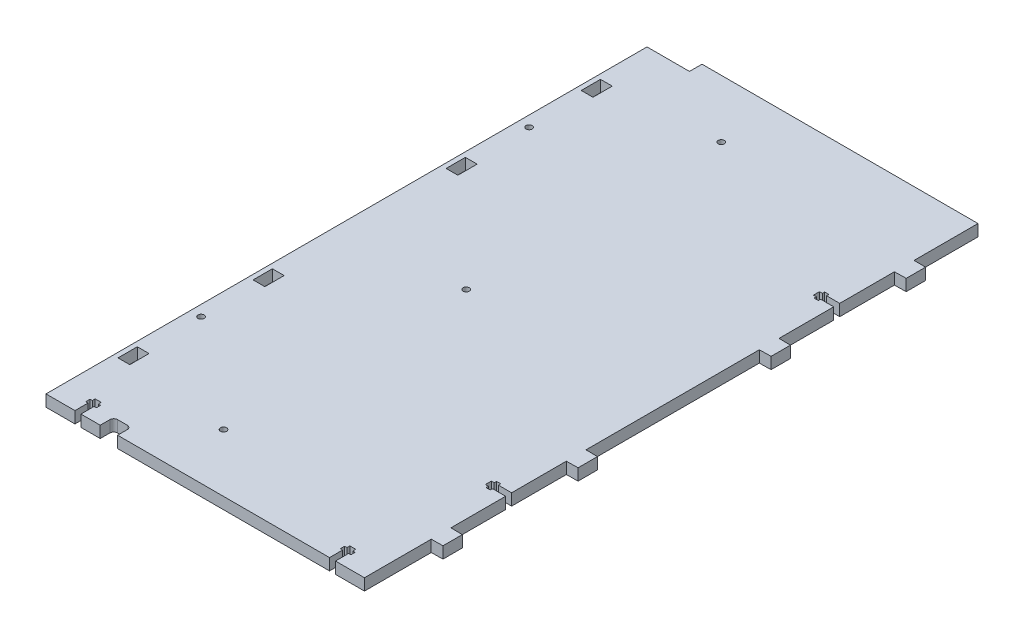
from build123d import *

# Parameters (mm, degrees)
SKETCH_1_R      = 1.6
SKETCH_1_W      = 6.1
SKETCH_1_H      = 10
EXTRUDE_1_DEPTH = 6


with BuildPart() as part:
    # Эскиз1 → Бобышка-Вытянуть1 (new body)
    with BuildSketch(Plane(origin=(0, 0, 6), x_dir=(1, 0, 0), z_dir=(0, 1, 0))):
        with BuildLine():
            Line((933.155518961, 517.721066), (933.155518961, 552.32339))
            Line((933.155518961, 552.32339), (939.155518961, 552.42339))
            Line((939.155518961, 552.42339), (939.155518961, 562.42339))
            Line((939.155518961, 562.42339), (933.155518961, 562.52339))
            Line((933.155518961, 562.52339), (933.155518961, 590.87339))
            Line((933.155518961, 590.87339), (926.355518961, 590.87339))
            Line((926.355518961, 590.87339), (926.355518961, 589.67339))
            Line((926.355518961, 589.67339), (924.155518961, 589.67339))
            Line((924.155518961, 589.67339), (924.155518961, 590.87339))
            Line((924.155518961, 590.87339), (922.655518961, 590.87339))
            Line((922.655518961, 590.87339), (922.655518961, 593.97339))
            Line((922.655518961, 593.97339), (924.155518961, 593.97339))
            Line((924.155518961, 593.97339), (924.155518961, 595.17339))
            Line((924.155518961, 595.17339), (926.355518961, 595.17339))
            Line((926.355518961, 595.17339), (926.355518961, 593.97339))
            Line((926.355518961, 593.97339), (933.155518961, 593.97339))
            Line((933.155518961, 593.97339), (933.155518961, 622.32339))
            Line((933.155518961, 622.32339), (939.155518961, 622.42339))
            Line((939.155518961, 622.42339), (939.155518961, 632.42339))
            Line((939.155518961, 632.42339), (933.155518961, 632.52339))
            Line((933.155518961, 632.52339), (933.155518961, 722.32339))
            Line((933.155518961, 722.32339), (939.155518961, 722.42339))
            Line((939.155518961, 722.42339), (939.155518961, 732.42339))
            Line((939.155518961, 732.42339), (933.155518961, 732.52339))
            Line((933.155518961, 732.52339), (933.155518961, 760.87339))
            Line((933.155518961, 760.87339), (926.355518961, 760.87339))
            Line((926.355518961, 760.87339), (926.355518961, 759.67339))
            Line((926.355518961, 759.67339), (924.155518961, 759.67339))
            Line((924.155518961, 759.67339), (924.155518961, 760.87339))
            Line((924.155518961, 760.87339), (922.655518961, 760.87339))
            Line((922.655518961, 760.87339), (922.655518961, 763.97339))
            Line((922.655518961, 763.97339), (924.155518961, 763.97339))
            Line((924.155518961, 763.97339), (924.155518961, 765.17339))
            Line((924.155518961, 765.17339), (926.355518961, 765.17339))
            Line((926.355518961, 765.17339), (926.355518961, 763.97339))
            Line((926.355518961, 763.97339), (933.155518961, 763.97339))
            Line((933.155518961, 763.97339), (933.155518961, 792.32339))
            Line((933.155518961, 792.32339), (939.155518961, 792.42339))
            Line((939.155518961, 792.42339), (939.155518961, 802.42339))
            Line((939.155518961, 802.42339), (933.155518961, 802.52339))
            Line((933.155518961, 802.52339), (933.155518961, 835.62339))
            Line((933.155518961, 835.62339), (833.155518961, 835.62339))
            Line((833.155518961, 835.62339), (790.155518961, 835.62339))
            Line((790.155518961, 835.62339), (790.155518961, 829.12339))
            Line((790.155518961, 829.12339), (768.155518961, 829.12339))
            Line((768.155518961, 829.12339), (768.155518961, 517.721066))
            Line((768.155518961, 517.721066), (783.155518961, 517.721066))
            Line((783.155518961, 517.721066), (783.155518961, 524.521066))
            Line((783.155518961, 524.521066), (781.955518961, 524.521066))
            Line((781.955518961, 524.521066), (781.955518961, 526.721066))
            Line((781.955518961, 526.721066), (783.155518961, 526.721066))
            Line((783.155518961, 526.721066), (783.155518961, 528.221066))
            Line((783.155518961, 528.221066), (786.255518961, 528.221066))
            Line((786.255518961, 528.221066), (786.255518961, 526.721066))
            Line((786.255518961, 526.721066), (787.455518961, 526.721066))
            Line((787.455518961, 526.721066), (787.455518961, 524.521066))
            Line((787.455518961, 524.521066), (786.255518961, 524.521066))
            Line((786.255518961, 524.521066), (786.255518961, 517.721066))
            Line((786.255518961, 517.721066), (796.255518961, 517.721066))
            Line((796.255518961, 517.721066), (796.255518961, 522.721066))
            ThreePointArc((796.255518961, 522.721066), (796.841305399, 524.135279562), (798.255518961, 524.721066))
            Line((798.255518961, 524.721066), (803.255518961, 524.721066))
            ThreePointArc((803.255518961, 524.721066), (804.669732523, 524.135279562), (805.255518961, 522.721066))
            Line((805.255518961, 522.721066), (805.255518961, 517.721066))
            Line((805.255518961, 517.721066), (833.155518961, 517.721066))
            Line((833.155518961, 517.721066), (915.055518961, 517.721066))
            Line((915.055518961, 517.721066), (915.055518961, 524.521066))
            Line((915.055518961, 524.521066), (913.855518961, 524.521066))
            Line((913.855518961, 524.521066), (913.855518961, 526.721066))
            Line((913.855518961, 526.721066), (915.055518961, 526.721066))
            Line((915.055518961, 526.721066), (915.055518961, 528.221066))
            Line((915.055518961, 528.221066), (918.155518961, 528.221066))
            Line((918.155518961, 528.221066), (918.155518961, 526.721066))
            Line((918.155518961, 526.721066), (919.355518961, 526.721066))
            Line((919.355518961, 526.721066), (919.355518961, 524.521066))
            Line((919.355518961, 524.521066), (918.155518961, 524.521066))
            Line((918.155518961, 524.521066), (918.155518961, 517.721066))
            Line((918.155518961, 517.721066), (933.155518961, 517.721066))
        make_face()
        with Locations((830.155518961, 805.62339)):
            Circle(SKETCH_1_R, mode=Mode.SUBTRACT)
        with Locations((830.155518961, 673.422228)):
            Circle(SKETCH_1_R, mode=Mode.SUBTRACT)
        with Locations((830.155518961, 547.721066)):
            Circle(SKETCH_1_R, mode=Mode.SUBTRACT)
        with Locations((773.705518961, 592.52339)):
            Circle(SKETCH_1_R, mode=Mode.SUBTRACT)
        with Locations((773.705518961, 762.52339)):
            Circle(SKETCH_1_R, mode=Mode.SUBTRACT)
        with Locations((773.705518961, 557.52339)):
            Rectangle(SKETCH_1_W, SKETCH_1_H, mode=Mode.SUBTRACT)
        with Locations((773.705518961, 627.52339)):
            Rectangle(SKETCH_1_W, SKETCH_1_H, mode=Mode.SUBTRACT)
        with Locations((773.705518961, 727.52339)):
            Rectangle(SKETCH_1_W, SKETCH_1_H, mode=Mode.SUBTRACT)
        with Locations((773.705518961, 797.52339)):
            Rectangle(SKETCH_1_W, SKETCH_1_H, mode=Mode.SUBTRACT)
    extrude(amount=-EXTRUDE_1_DEPTH)


solid = part.part
